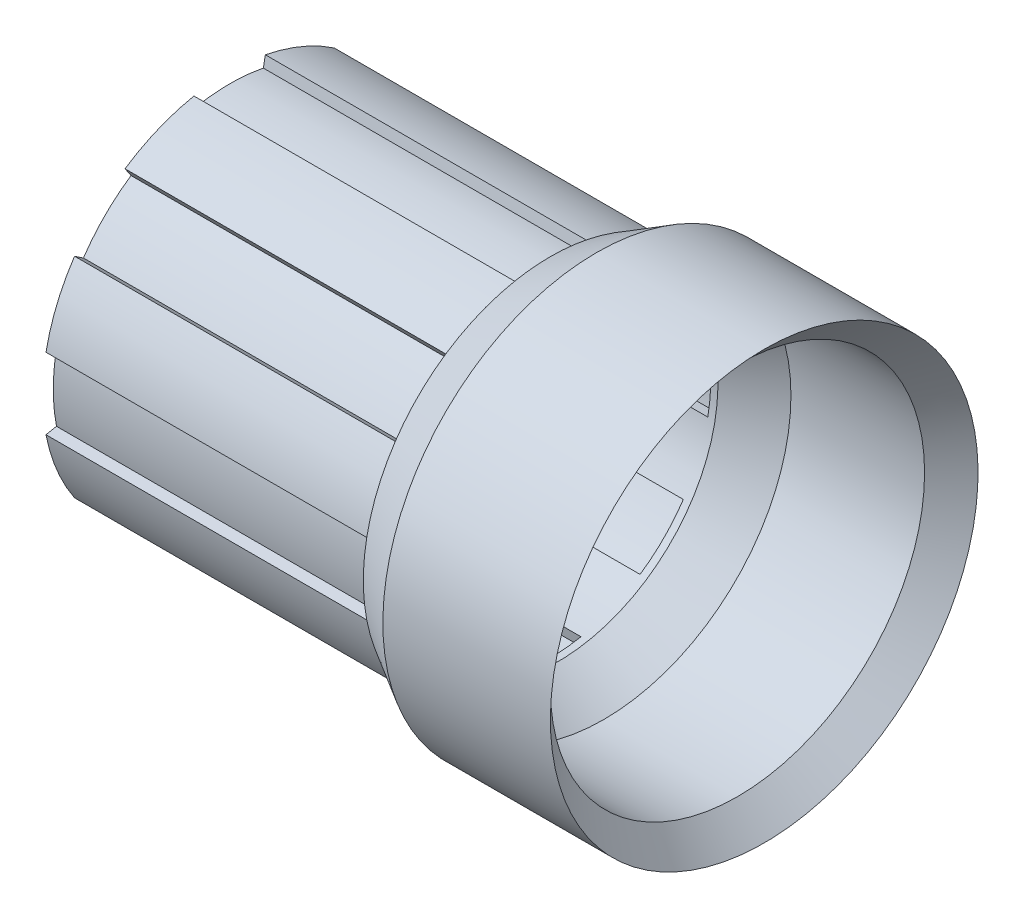
from build123d import *

# Parameters (mm, degrees)
CUT_EXTRUDE1_DEPTH = 6
CIRPATTERN1_COUNT  = 8
CHAMFER1_SIZE      = 0.5


with BuildPart() as part:
    # Sketch2 → Revolve1 (revolve)
    with BuildSketch(Plane.XY):
        Polygon((-10, 3), (-10, 3.5), (-4, 3.5), (-3.133974596, 4), (0, 4), (0, 3.5), (-3, 3.5), (-3.866025404, 3), align=None)
    revolve(axis=Axis((-10, 0, 0), (-1, 0, 0)))

    # Sketch3 → Cut-Extrude1 (cut)
    with BuildSketch(Plane.ZY.offset(10)):
        with BuildLine():
            Line((0.572426986, 2.94488155), (0.610588785, 3.141206987))
            ThreePointArc((0.610588785, 3.141206987), (0, 3.2), (-0.610588785, 3.141206987))
            Line((-0.610588785, 3.141206987), (-0.572426986, 2.94488155))
            ThreePointArc((-0.572426986, 2.94488155), (0, 3), (0.572426986, 2.94488155))
        make_face()
        with BuildLine():
            Line((-0.629669685, 3.239369705), (-0.667831484, 3.435695142))
            ThreePointArc((-0.667831484, 3.435695142), (0, 3.5), (0.667831484, 3.435695142))
            Line((0.667831484, 3.435695142), (0.629669685, 3.239369705))
            ThreePointArc((0.629669685, 3.239369705), (0, 3.3), (-0.629669685, 3.239369705))
        make_face()
    cut_extrude1 = extrude(amount=-CUT_EXTRUDE1_DEPTH, mode=Mode.SUBTRACT)

    # CirPattern1: Cut-Extrude1 ×8 about axis
    cirpattern1_axis = Axis((0, 0, 0), (1, 0, 0))
    for i in range(1, CIRPATTERN1_COUNT):
        add(cut_extrude1.rotate(cirpattern1_axis, i * 360 / CIRPATTERN1_COUNT), mode=Mode.SUBTRACT)

    # Chamfer1
    chamfer1_edges = [part.edges().sort_by_distance(p)[0] for p in [
        (0, -3.5, 0),
    ]]
    chamfer(chamfer1_edges, length=CHAMFER1_SIZE - 0.0001)  # a hair under: the kernel refuses the full size


solid = part.part
